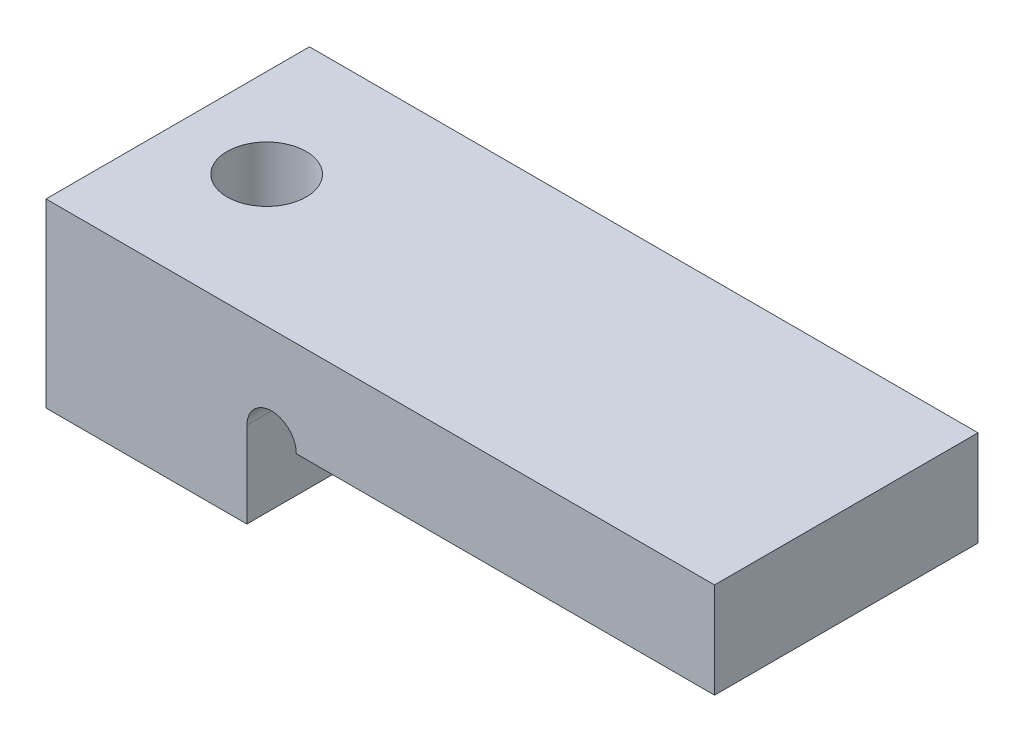
from build123d import *

# Parameters (mm, degrees)
BOSS_EXTRUDE2_DEPTH     = 4
CUT_EXTRUDE2_DEPTH      = 22.408876664
CUT_EXTRUDE2_DEPTH_BACK = 22.408876664
SKETCH2_R               = 1.2
CUT_EXTRUDE3_DEPTH      = 22.408876664
CUT_EXTRUDE3_DEPTH_BACK = 22.408876664
SKETCH3_R               = 0.75


with BuildPart() as part:
    # Sketch1 → Boss-Extrude2 (new, symmetric)
    with BuildSketch(Plane.XY):
        Polygon((0, 0), (6.1, 0), (6.1, 2.6), (20.3, 2.6), (20.3, 5.5), (0, 5.5), align=None)
    extrude(amount=BOSS_EXTRUDE2_DEPTH, both=True)

    # Sketch2 → Cut-Extrude2 (cut, two sides: drawn at the far end of the back side and taken through both)
    with BuildSketch(Plane(origin=(0, 0, 0), x_dir=(1, 0, 0), z_dir=(0, 1, 0)).offset(-CUT_EXTRUDE2_DEPTH_BACK)):
        with Locations((2.7, 0)):
            Circle(SKETCH2_R)
    extrude(amount=CUT_EXTRUDE2_DEPTH + CUT_EXTRUDE2_DEPTH_BACK, mode=Mode.SUBTRACT)

    # Sketch3 → Cut-Extrude3 (cut, two sides: drawn at the far end of the back side and taken through both)
    with BuildSketch(Plane.XY.offset(-CUT_EXTRUDE3_DEPTH_BACK)):
        with Locations((6.85, 2.6)):
            Circle(SKETCH3_R)
    extrude(amount=CUT_EXTRUDE3_DEPTH + CUT_EXTRUDE3_DEPTH_BACK, mode=Mode.SUBTRACT)


solid = part.part
